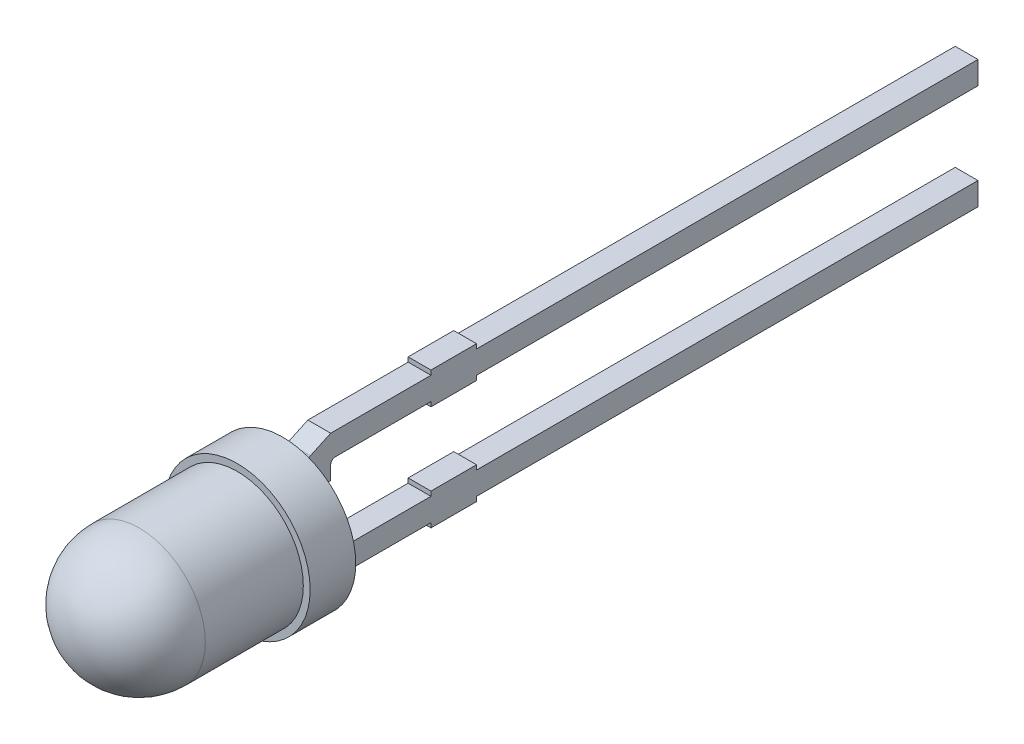
from build123d import *

# Parameters (mm, degrees)
EXTRUDE1_DEPTH          = 0.25
FILLET1_R               = 0.25
CUT_EXTRUDE1_DEPTH      = 31.234789562
CUT_EXTRUDE1_DEPTH_BACK = 31.234789562
SKETCH3_W               = 12
SKETCH3_H               = 2.8


with BuildPart() as part:
    # Sketch1 → Revolve1 (revolve)
    with BuildSketch(Plane(origin=(0, 0, 0), x_dir=(0, 0, -1), z_dir=(1, 0, 0))):
        with BuildLine():
            Line((0, 1.45), (2.15, 1.45))
            Line((2.15, 1.45), (2.15, 1.599999975))
            Line((2.15, 1.599999975), (3.15, 1.599999975))
            Line((3.15, 1.599999975), (3.15, 0))
            Line((3.15, 0), (-1.45, 0))
            ThreePointArc((-1.45, 0), (-1.025304833, 1.025304833), (0, 1.45))
        make_face()
    revolve(axis=Axis((0, 0, 0), (0, 0, -1)))

    # Sketch2 → Extrude1 (add, symmetric)
    with BuildSketch(Plane(origin=(0, 0, 0), x_dir=(0, 0, -1), z_dir=(1, 0, 0))):
        with BuildLine():
            Line((3.15, 1.026953873), (3.95, 1.4))
            Line((3.95, 1.4), (6.15, 1.4))
            Line((6.15, 1.4), (6.15, 1.5))
            Line((6.15, 1.5), (7.15, 1.5))
            Line((7.15, 1.5), (7.15, 1.4))
            Line((7.15, 1.4), (30.15, 1.4))
            Line((30.15, 1.4), (30.15, 0.9))
            Line((30.15, 0.9), (7.15, 0.9))
            Line((7.15, 0.9), (7.15, 0.8))
            Line((7.15, 0.8), (6.15, 0.8))
            Line((6.15, 0.8), (6.15, 0.9))
            Line((6.15, 0.9), (4.05, 0.9))
            ThreePointArc((4.05, 0.9), (3.979289322, 0.870710678), (3.95, 0.8))
            Line((3.95, 0.8), (3.95, 0.5))
            Line((3.95, 0.5), (3.15, 0.5))
            Line((3.15, 0.5), (3.15, 1.026953873))
        make_face()
        with BuildLine():
            Line((3.95, -0.8), (3.95, -0.5))
            Line((3.95, -0.5), (3.15, -0.5))
            Line((3.15, -0.5), (3.15, -1.026953873))
            Line((3.15, -1.026953873), (3.95, -1.4))
            Line((3.95, -1.4), (6.15, -1.4))
            Line((6.15, -1.4), (6.15, -1.5))
            Line((6.15, -1.5), (7.15, -1.5))
            Line((7.15, -1.5), (7.15, -1.4))
            Line((7.15, -1.4), (30.15, -1.4))
            Line((30.15, -1.4), (30.15, -0.9))
            Line((30.15, -0.9), (7.15, -0.9))
            Line((7.15, -0.9), (7.15, -0.8))
            Line((7.15, -0.8), (6.15, -0.8))
            Line((6.15, -0.8), (6.15, -0.9))
            Line((6.15, -0.9), (4.05, -0.9))
            ThreePointArc((4.05, -0.9), (3.979289322, -0.870710678), (3.95, -0.8))
        make_face()
    extrude(amount=EXTRUDE1_DEPTH, both=True)

    # Fillet1
    fillet1_edges = [part.edges().sort_by_distance(p)[0] for p in [
        (0, -0.5, -3.15),
        (0, -1.026953873, -3.15),
        (-0.25, -0.763476937, -3.15),
        (0, 0.5, -3.15),
        (-0.25, 0.763476937, -3.15),
        (0, 1.026953873, -3.15),
        (0.25, 0.763476937, -3.15),
        (0.25, -0.763476937, -3.15),
    ]]
    fillet(fillet1_edges, radius=FILLET1_R)

    # Sketch3 → Cut-Extrude1 (cut, two sides: drawn at the far end of the back side and taken through both)
    with BuildSketch(Plane(origin=(0, 0, 0), x_dir=(0, 0, -1), z_dir=(1, 0, 0)).offset(-CUT_EXTRUDE1_DEPTH_BACK)):
        with Locations((24.15, 0)):
            Rectangle(SKETCH3_W, SKETCH3_H)
    extrude(amount=CUT_EXTRUDE1_DEPTH + CUT_EXTRUDE1_DEPTH_BACK, mode=Mode.SUBTRACT)


solid = part.part
